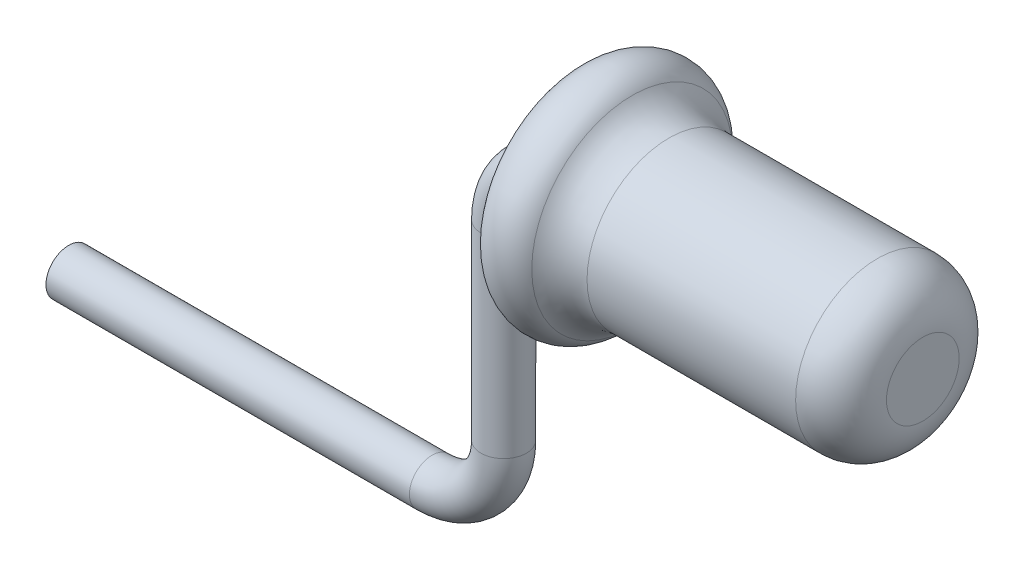
from build123d import *

# Parameters (mm, degrees)
SKETCH3_R = 2.5


with BuildPart() as part:
    # Sweep1: sweep along a path in Sketch1
    with BuildLine(Plane.XY) as sweep1_path:
        Line((-15.563195439, 0), (24.436804561, 0))
        ThreePointArc((24.436804561, 0), (30.004211849, 2.306095606), (32.310307454, 7.873502893))
        Line((32.310307454, 7.873502893), (32.310307454, 28.873502893))
        ThreePointArc((32.310307454, 28.873502893), (34.61640306, 34.44091018), (40.183810347, 36.747005786))
        Line((40.183810347, 36.747005786), (75.183810347, 36.747005786))
    # Sketch3 → Sweep1 (sweep)
    with BuildSketch(Plane(origin=(-15.563195439, 0, 0), x_dir=(0, 0, -1), z_dir=(1, 0, 0))):
        Circle(SKETCH3_R)
    sweep(path=sweep1_path.line)

    # Sketch4 → Revolve1 (revolve)
    with BuildSketch(Plane.XY):
        with BuildLine():
            Line((40.183810347, 39.247005786), (75.183810347, 39.247005786))
            Line((75.183810347, 39.247005786), (75.183810347, 36.747005786))
            Line((75.183810347, 36.747005786), (78.44282912, 36.747005786))
            Line((78.44282912, 36.747005786), (78.44282912, 39.247005786))
            Line((78.44282912, 39.247005786), (78.44282912, 40.747005786))
            ThreePointArc((78.44282912, 40.747005786), (76.978363026, 44.282539692), (73.44282912, 45.747005786))
            Line((73.44282912, 45.747005786), (50.486594242, 45.747005786))
            ThreePointArc((50.486594242, 45.747005786), (48.223967686, 46.288247992), (46.451192725, 47.794797358))
            ThreePointArc((46.451192725, 47.794797358), (42.574882642, 49.043728863), (40.183810347, 45.747005786))
            Line((40.183810347, 45.747005786), (40.183810347, 39.247005786))
        make_face()
    revolve(axis=Axis((40.183810347, 36.747005786, 0), (1, 0, 0)))


solid = part.part
